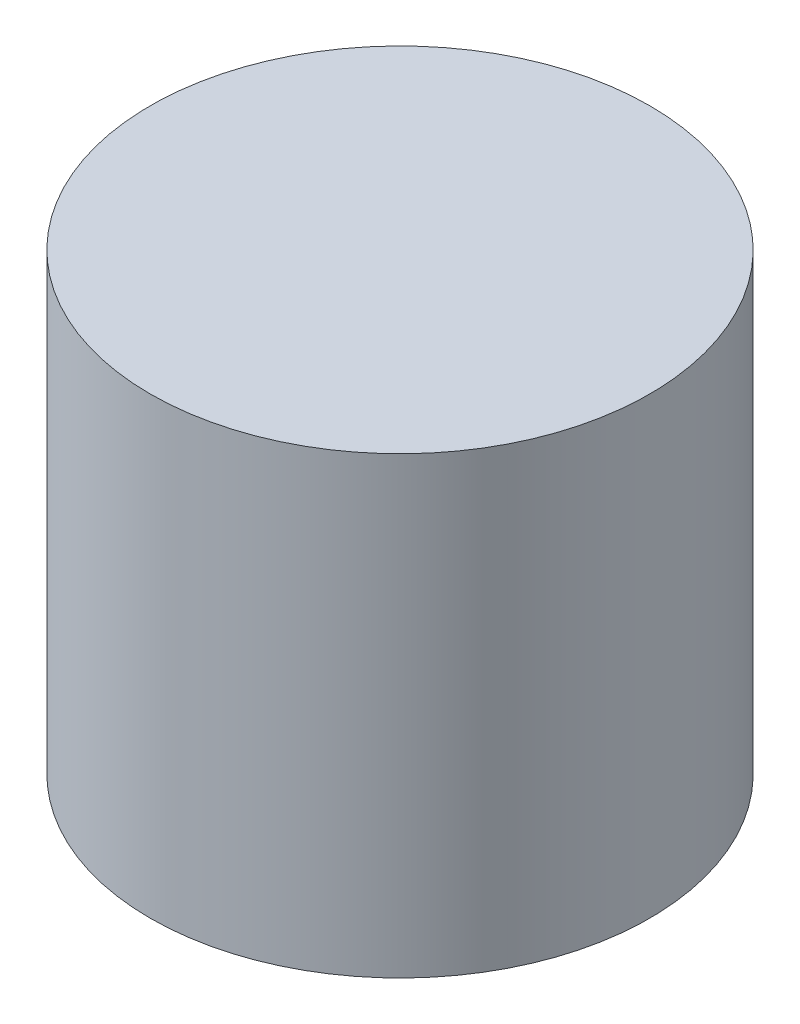
from build123d import *

# Parameters (mm, degrees)
SKETCH1_R           = 11
BOSS_EXTRUDE1_DEPTH = 20


with BuildPart() as part:
    # Sketch1 → Boss-Extrude1 (new body)
    with BuildSketch(Plane(origin=(0, 0, 0), x_dir=(1, 0, 0), z_dir=(0, 1, 0))):
        Circle(SKETCH1_R)
    extrude(amount=BOSS_EXTRUDE1_DEPTH)


solid = part.part
